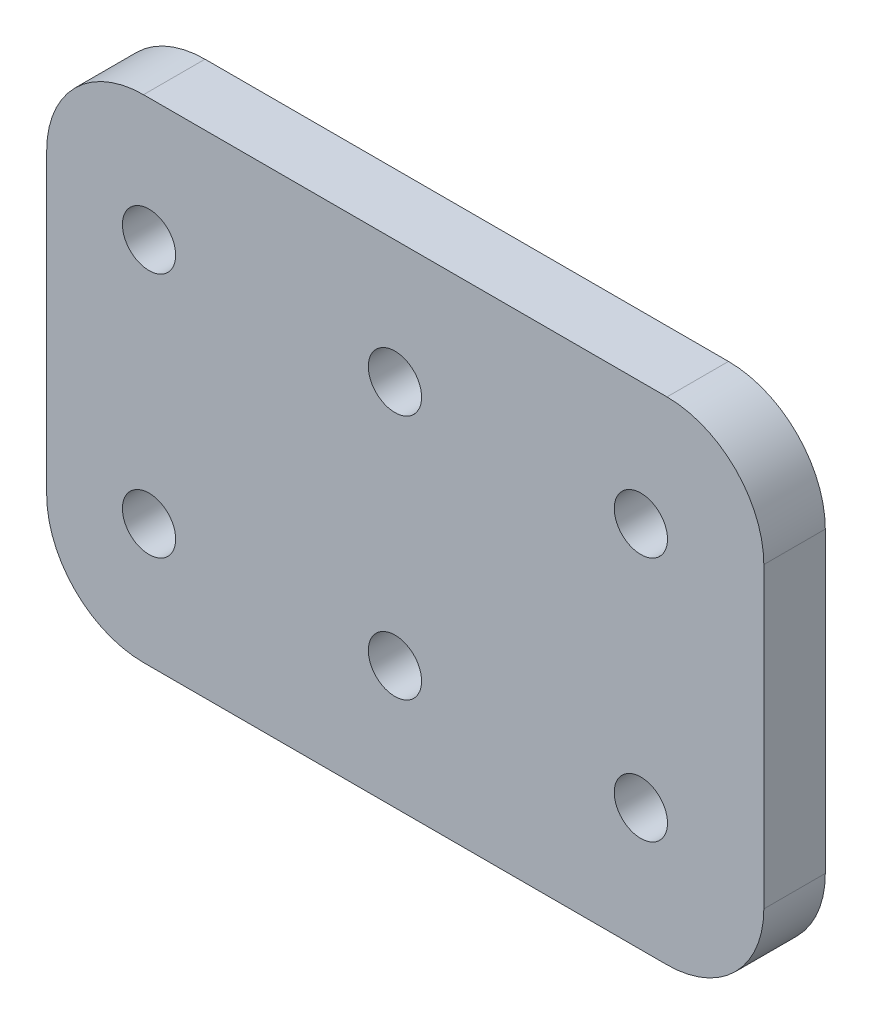
from build123d import *

# Parameters (mm, degrees)
SKETCH1_W            = 74.07
SKETCH1_H            = 50.8
BOSS_EXTRUDE1_DEPTH  = 6.35
FILLET1_R            = 10
M5_CLEARANCE_HOLE1_D = 5.5


with BuildPart() as part:
    # Sketch1 → Boss-Extrude1 (new body)
    with BuildSketch(Plane.XY):
        Rectangle(SKETCH1_W, SKETCH1_H)
    extrude(amount=BOSS_EXTRUDE1_DEPTH)

    # Fillet1
    fillet1_edges = [part.edges().sort_by_distance(p)[0] for p in [
        (-37.035, -25.4, 3.175),
        (37.035, -25.4, 3.175),
        (37.035, 25.4, 3.175),
        (-37.035, 25.4, 3.175),
    ]]
    fillet(fillet1_edges, radius=FILLET1_R)

    # M5 Clearance Hole1 (through all)
    with Locations(Plane.XY.offset(6.35)):
        with Locations((-26.465, 12.7), (-26.465, -12.7), (-1.065, -12.7), (-1.065, 12.7), (24.335, 12.7), (24.335, -12.7)):
            Hole(M5_CLEARANCE_HOLE1_D / 2)


solid = part.part
